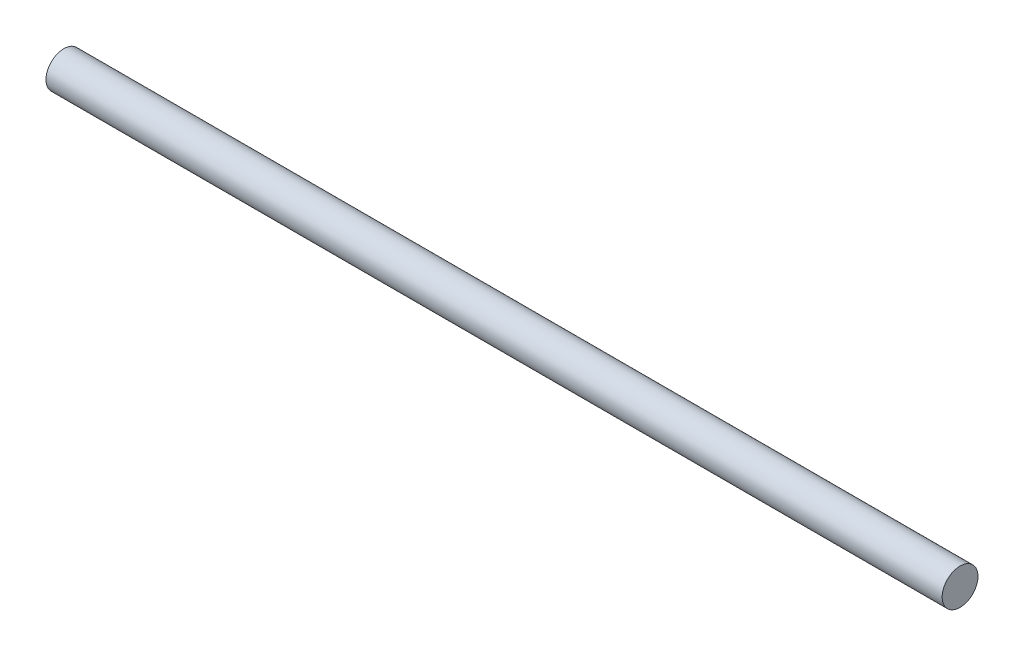
from build123d import *

# Parameters (mm, degrees)
CROQUIS1_R              = 4
SALIENTE_EXTRUIR1_DEPTH = 200


with BuildPart() as part:
    # Croquis1 → Saliente-Extruir1 (new body)
    with BuildSketch(Plane(origin=(0, 0, 0), x_dir=(0, 0, -1), z_dir=(1, 0, 0))):
        Circle(CROQUIS1_R)
    extrude(amount=SALIENTE_EXTRUIR1_DEPTH)


solid = part.part
